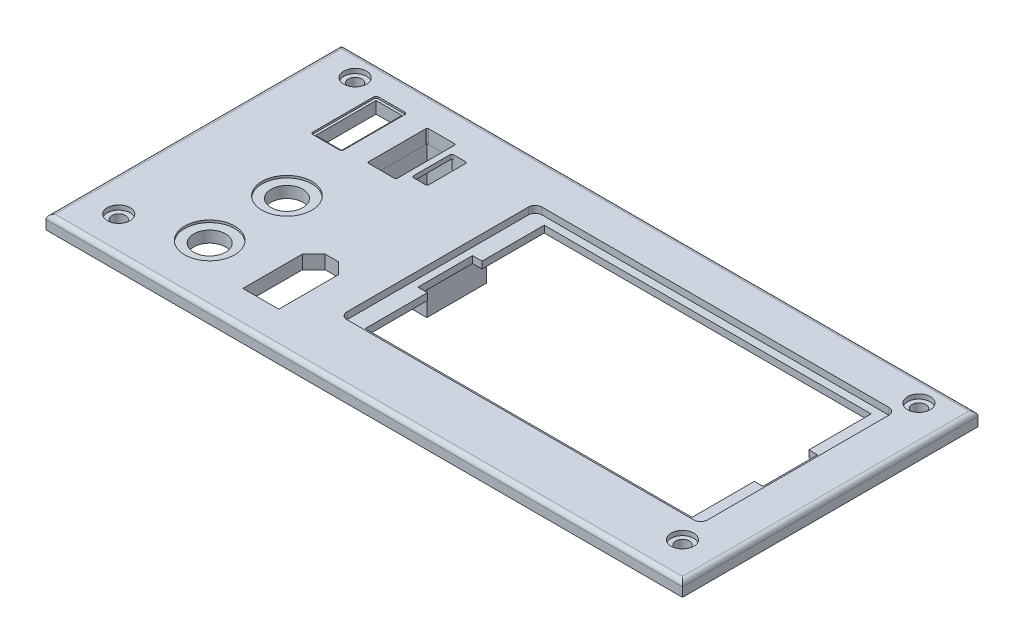
from build123d import *

# Parameters (mm, degrees)
SKETCH_1_W             = 140
SKETCH_1_H             = 65
EXTRUDE_307_DEPTH      = 3
SKETCH_2_W             = 79.3
SKETCH_2_H             = 42.9
CUT_EXTRUDE_542_DEPTH  = 1.5
FILLET_597_R           = 1.5
SKETCH_3_W             = 71.9
SKETCH_3_H             = 39.4
CUT_EXTRUDE_1214_DEPTH = 3
SKETCH_4_W             = 4.2
SKETCH_4_H             = 12
CUT_EXTRUDE_1603_DEPTH = 3
SKETCH_5_R             = 5.5
CUT_EXTRUDE_1905_DEPTH = 0.5
SKETCH_6_R             = 3.5
CUT_EXTRUDE_2045_DEPTH = 3
SKETCH_7_W             = 6.8
SKETCH_7_H             = 14.4
USB_DEPTH              = 0.4
SKETCH_8_W             = 5.7
SKETCH_8_H             = 13.3
USB_2_DEPTH            = 3
F_1_USB_R              = 0.5
XT60_DEPTH             = 88.372764635
SKETCH_10_R            = 1.5
CUT_EXTRUDE_4241_DEPTH = 88.372764635
SKETCH_13_R            = 2.5
CUT_EXTRUDE_4755_DEPTH = 1
FILLET_1_R             = 1
CUT_EXTRUDE_1_DEPTH    = 3
FILLET_2_R             = 0.4
FILLET_3_R             = 0.3
SKETCH_15_W            = 1.3
SKETCH_15_H            = 18.4
EXTRUDE_1_DEPTH        = 1
FILLET_4_R             = 0.3
FILLET_5_R             = 0.4
EXTRUDE_1_2_DEPTH      = 20


with BuildPart() as part:
    # Sketch 1 → Extrude 307 (new body)
    with BuildSketch(Plane(origin=(0, 0, 0), x_dir=(1, 0, 0), z_dir=(0, 1, 0))):
        with Locations((10, -2.5)):
            Rectangle(SKETCH_1_W, SKETCH_1_H)
    extrude(amount=EXTRUDE_307_DEPTH)

    # Sketch 2 → Cut-Extrude 542 (cut)
    with BuildSketch(Plane(origin=(0, 3, 0), x_dir=(1, 0, 0), z_dir=(0, 1, 0))):
        with Locations((31.35, -0.55)):
            Rectangle(SKETCH_2_W, SKETCH_2_H)
    extrude(amount=-CUT_EXTRUDE_542_DEPTH, mode=Mode.SUBTRACT)

    # Fillet 597
    fillet_597_edges = [part.edges().sort_by_distance(p)[0] for p in [
        (71, 2.25, 22),
        (-8.3, 2.25, 22),
        (71, 2.25, -20.9),
        (-8.3, 2.25, -20.9),
    ]]
    fillet(fillet_597_edges, radius=FILLET_597_R)

    # Sketch 3 → Cut-Extrude 1214 (cut)
    with BuildSketch(Plane(origin=(0, 1.5, 0), x_dir=(1, 0, 0), z_dir=(0, 1, 0))):
        with Locations((31.35, -0.5)):
            Rectangle(SKETCH_3_W, SKETCH_3_H)
    extrude(amount=-CUT_EXTRUDE_1214_DEPTH, mode=Mode.SUBTRACT)

    # Sketch 4 → Cut-Extrude 1603 (cut)
    with BuildSketch(Plane(origin=(0, 1.5, 0), x_dir=(1, 0, 0), z_dir=(0, 1, 0))):
        with Locations((-4.6, -0.5)):
            Rectangle(SKETCH_4_W, SKETCH_4_H)
        with Locations((67.1, -0.5)):
            Rectangle(SKETCH_4_W, SKETCH_4_H)
    extrude(amount=-CUT_EXTRUDE_1603_DEPTH, mode=Mode.SUBTRACT)

    # Sketch 5 → Cut-Extrude 1905 (cut)
    with BuildSketch(Plane(origin=(0, 3, 0), x_dir=(1, 0, 0), z_dir=(0, 1, 0))):
        with Locations((-37, -5)):
            Circle(SKETCH_5_R)
        with Locations((-37, -22)):
            Circle(SKETCH_5_R)
    extrude(amount=-CUT_EXTRUDE_1905_DEPTH, mode=Mode.SUBTRACT)

    # Sketch 6 → Cut-Extrude 2045 (cut)
    with BuildSketch(Plane(origin=(0, 2.5, 0), x_dir=(1, 0, 0), z_dir=(0, 1, 0))):
        with Locations((-37, -5)):
            Circle(SKETCH_6_R)
        with Locations((-37, -22)):
            Circle(SKETCH_6_R)
    extrude(amount=-CUT_EXTRUDE_2045_DEPTH, mode=Mode.SUBTRACT)

    # Sketch 7 → USB (cut)
    with BuildSketch(Plane(origin=(0, 3, 0), x_dir=(1, 0, 0), z_dir=(0, 1, 0))):
        with Locations((-42.9, 16.7)):
            Rectangle(SKETCH_7_W, SKETCH_7_H)
    extrude(amount=-USB_DEPTH, mode=Mode.SUBTRACT)

    # Sketch 8 → USB 2 (cut)
    with BuildSketch(Plane(origin=(0, 2.6, 0), x_dir=(1, 0, 0), z_dir=(0, 1, 0))):
        with Locations((-42.9, 16.7)):
            Rectangle(SKETCH_8_W, SKETCH_8_H)
    extrude(amount=-USB_2_DEPTH, mode=Mode.SUBTRACT)

    # 1 USB
    f_1_usb_edges = [part.edges().sort_by_distance(p)[0] for p in [
        (-46.3, 2.8, -9.5),
        (-39.5, 2.8, -9.5),
        (-39.5, 2.8, -23.9),
        (-46.3, 2.8, -23.9),
    ]]
    fillet(f_1_usb_edges, radius=F_1_USB_R)

    # Sketch 9 → XT60 (cut, through all)
    with BuildSketch(Plane(origin=(0, 3, 0), x_dir=(1, 0, 0), z_dir=(0, 1, 0))):
        Polygon((-24.2, -27.5), (-16.3, -27.5), (-16.3, -14.4), (-18.8, -11.9), (-21.7, -11.9), (-24.2, -14.4), align=None)
    extrude(amount=-XT60_DEPTH, mode=Mode.SUBTRACT)

    # Sketch 10 → Cut-Extrude 4241 (cut, through all)
    with BuildSketch(Plane(origin=(0, 3, 0), x_dir=(1, 0, 0), z_dir=(0, 1, 0))):
        with Locations((-52, 25)):
            Circle(SKETCH_10_R)
        with Locations((72, 25)):
            Circle(SKETCH_10_R)
        with Locations((72, -27)):
            Circle(SKETCH_10_R)
        with Locations((-52, -27)):
            Circle(SKETCH_10_R)
    extrude(amount=-CUT_EXTRUDE_4241_DEPTH, mode=Mode.SUBTRACT)

    # Sketch 13 → Cut-Extrude 4755 (cut)
    with BuildSketch(Plane(origin=(0, 3, 0), x_dir=(1, 0, 0), z_dir=(0, 1, 0))):
        with Locations((-52, 25)):
            Circle(SKETCH_13_R)
        with Locations((72, 25)):
            Circle(SKETCH_13_R)
        with Locations((72, -27)):
            Circle(SKETCH_13_R)
        with Locations((-52, -27)):
            Circle(SKETCH_13_R)
    extrude(amount=-CUT_EXTRUDE_4755_DEPTH, mode=Mode.SUBTRACT)

    # Fillet 1
    fillet_1_edges = [part.edges().sort_by_distance(p)[0] for p in [
        (10, 3, 35),
        (80, 3, 2.5),
        (-60, 3, 2.5),
        (10, 3, -30),
    ]]
    fillet(fillet_1_edges, radius=FILLET_1_R)

    # Sketch 14 → Cut-Extrude 1 (cut)
    with BuildSketch(Plane(origin=(0, 3, 0), x_dir=(1, 0, 0), z_dir=(0, 1, 0))):
        Polygon((-28.2, 10.15), (-34.5, 10.15), (-34.5, 23.35), (-28.2, 23.35), (-28.2, 25.9), (-26.9, 25.89999993), (-26.9, 21.14999993), (-23.5, 21.14999993), (-23.5, 12.34999993), (-26.9, 12.34999993), (-26.9, 7.59999993), (-28.2, 7.6), align=None)
    extrude(amount=-CUT_EXTRUDE_1_DEPTH, mode=Mode.SUBTRACT)

    # Fillet 2
    fillet_2_edges = [part.edges().sort_by_distance(p)[0] for p in [
        (-23.5, 1.5, -12.34999993),
        (-23.5, 1.5, -21.14999993),
    ]]
    fillet(fillet_2_edges, radius=FILLET_2_R)

    # Fillet 3
    fillet_3_edges = [part.edges().sort_by_distance(p)[0] for p in [
        (-34.5, 1.5, -10.15),
        (-34.5, 1.5, -23.35),
    ]]
    fillet(fillet_3_edges, radius=FILLET_3_R)

    # Sketch 15 → Extrude 1 (add)
    with BuildSketch(Plane(origin=(0, 3, 0), x_dir=(1, 0, 0), z_dir=(0, 1, 0))):
        with Locations((-27.55, 16.799999965)):
            Rectangle(SKETCH_15_W, SKETCH_15_H)
    extrude(amount=-EXTRUDE_1_DEPTH)

    # Fillet 4
    fillet_4_edges = [part.edges().sort_by_distance(p)[0] for p in [
        (-28.2, 2.5, -10.15),
        (-28.2, 2.5, -23.35),
    ]]
    fillet(fillet_4_edges, radius=FILLET_4_R)

    # Fillet 5
    fillet_5_edges = [part.edges().sort_by_distance(p)[0] for p in [
        (-26.9, 2.5, -12.34999993),
        (-26.9, 2.5, -21.14999993),
    ]]
    fillet(fillet_5_edges, radius=FILLET_5_R)

    # Sketch 17 → Extrude 1 2 (add)
    with BuildSketch(Plane.XZ):
        Polygon((-36.618386658, -7.996110769), (-30.309338786, -7.996110769), (-30.309338786, -5.553278209), (-24.770546623, -5.553278209), (-24.770546623, -10.1696547), (-21.404438764, -10.1696547), (-21.404438764, -23.245547993), (-24.770546623, -23.245547993), (-24.770546623, -27.954623035), (-30.309338786, -27.954623035), (-30.309338786, -25.408557701), (-36.618386658, -25.408557701), align=None)
        Polygon((-34.618386658, -9.996110769), (-28.309338786, -9.996110769), (-28.309338786, -7.553278209), (-26.770546623, -7.553278209), (-26.770546623, -12.1696547), (-23.404438764, -12.1696547), (-23.404438764, -21.245547993), (-26.770546623, -21.245547993), (-26.770546623, -25.954623035), (-28.309338786, -25.954623035), (-28.309338786, -23.408557701), (-34.618386658, -23.408557701), align=None, mode=Mode.SUBTRACT)
    extrude(amount=EXTRUDE_1_2_DEPTH)


solid = part.part
